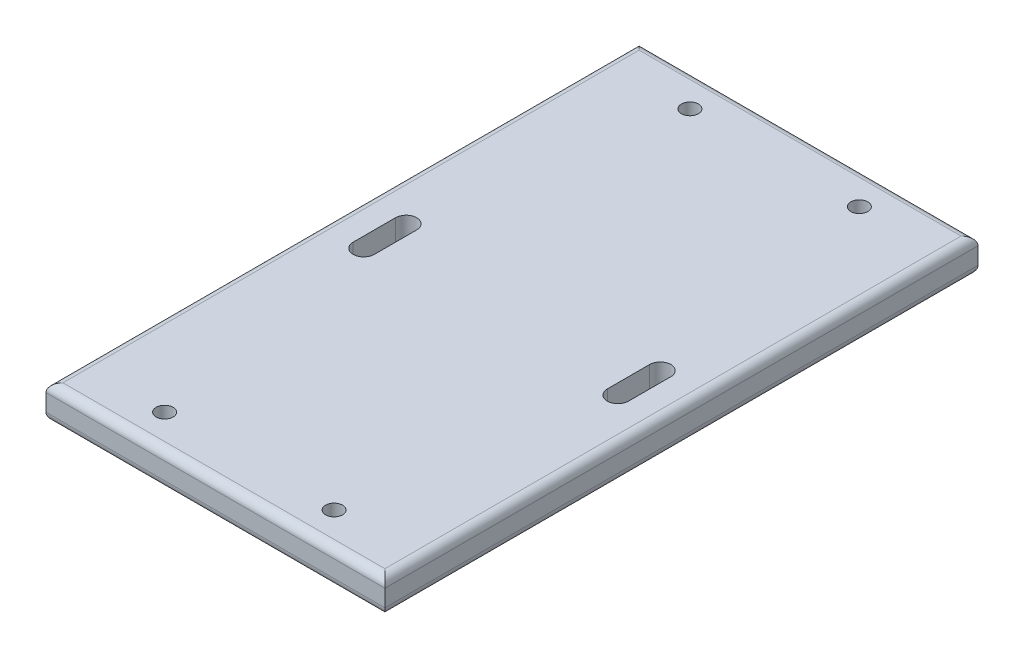
from build123d import *

# Parameters (mm, degrees)
SKETCH2_W               = 80
SKETCH2_H               = 140
BOSS_EXTRUDE1_DEPTH     = 5
SKETCH3_W               = 80
SKETCH3_H               = 140
BOSS_EXTRUDE2_DEPTH     = 3
FILLET1_R               = 2
CUT_EXTRUDE1_DEPTH      = 162.322658049
CUT_EXTRUDE1_DEPTH_BACK = 162.322658049
SKETCH6_R               = 2
CUT_EXTRUDE2_DEPTH      = 3


with BuildPart() as part:
    # Sketch2 → Boss-Extrude1 (new body)
    with BuildSketch(Plane(origin=(0, 0, 0), x_dir=(1, 0, 0), z_dir=(0, 1, 0))):
        with Locations((-40, 70)):
            Rectangle(SKETCH2_W, SKETCH2_H)
        with BuildLine():
            Line((-4, 28), (-4, 8))
            ThreePointArc((-4, 8), (-8, 4), (-12, 8))
            Line((-12, 8), (-12, 28))
            ThreePointArc((-12, 28), (-8, 32), (-4, 28))
        make_face(mode=Mode.SUBTRACT)
        with BuildLine():
            Line((-4, 112), (-4, 132))
            ThreePointArc((-4, 132), (-8, 136), (-12, 132))
            Line((-12, 132), (-12, 112))
            ThreePointArc((-12, 112), (-8, 108), (-4, 112))
        make_face(mode=Mode.SUBTRACT)
        with BuildLine():
            Line((-76, 112), (-76, 132))
            ThreePointArc((-76, 132), (-72, 136), (-68, 132))
            Line((-68, 132), (-68, 112))
            ThreePointArc((-68, 112), (-72, 108), (-76, 112))
        make_face(mode=Mode.SUBTRACT)
        with BuildLine():
            Line((-76, 28), (-76, 8))
            ThreePointArc((-76, 8), (-72, 4), (-68, 8))
            Line((-68, 8), (-68, 28))
            ThreePointArc((-68, 28), (-72, 32), (-76, 28))
        make_face(mode=Mode.SUBTRACT)
    extrude(amount=-BOSS_EXTRUDE1_DEPTH)

    # Sketch3 → Boss-Extrude2 (add)
    with BuildSketch(Plane(origin=(0, 0, 0), x_dir=(1, 0, 0), z_dir=(0, 1, 0))):
        with Locations((-40, 70)):
            Rectangle(SKETCH3_W, SKETCH3_H)
    extrude(amount=BOSS_EXTRUDE2_DEPTH)

    # Fillet1
    fillet1_edges = [part.edges().sort_by_distance(p)[0] for p in [
        (-40, -5, -140),
        (-40, 3, -140),
        (-80, -5, -70),
        (-80, 3, -70),
        (0, 3, -70),
        (0, -5, -70),
        (-40, -5, 0),
        (-40, 3, 0),
    ]]
    fillet(fillet1_edges, radius=FILLET1_R)

    # Sketch4 → Cut-Extrude1 (cut, two sides: drawn at the far end of the back side and taken through both)
    with BuildSketch(Plane(origin=(0, 0, 0), x_dir=(1, 0, 0), z_dir=(0, 1, 0)).offset(-CUT_EXTRUDE1_DEPTH_BACK)):
        with BuildLine():
            Line((-7.5, 75), (-7.5, 65))
            ThreePointArc((-7.5, 65), (-10, 62.5), (-12.5, 65))
            Line((-12.5, 65), (-12.5, 75))
            ThreePointArc((-12.5, 75), (-10, 77.5), (-7.5, 75))
        make_face()
        with BuildLine():
            Line((-72.5, 75), (-72.5, 65))
            ThreePointArc((-72.5, 65), (-70, 62.5), (-67.5, 65))
            Line((-67.5, 65), (-67.5, 75))
            ThreePointArc((-67.5, 75), (-70, 77.5), (-72.5, 75))
        make_face()
    extrude(amount=CUT_EXTRUDE1_DEPTH + CUT_EXTRUDE1_DEPTH_BACK, mode=Mode.SUBTRACT)

    # Sketch6 → Cut-Extrude2 (cut)
    with BuildSketch(Plane(origin=(0, 3, 0), x_dir=(1, 0, 0), z_dir=(0, 1, 0))):
        with Locations((-60, 132)):
            Circle(SKETCH6_R)
        with Locations((-20, 132)):
            Circle(SKETCH6_R)
        with Locations((-20, 8)):
            Circle(SKETCH6_R)
        with Locations((-60, 8)):
            Circle(SKETCH6_R)
    extrude(amount=-CUT_EXTRUDE2_DEPTH, mode=Mode.SUBTRACT)


solid = part.part
